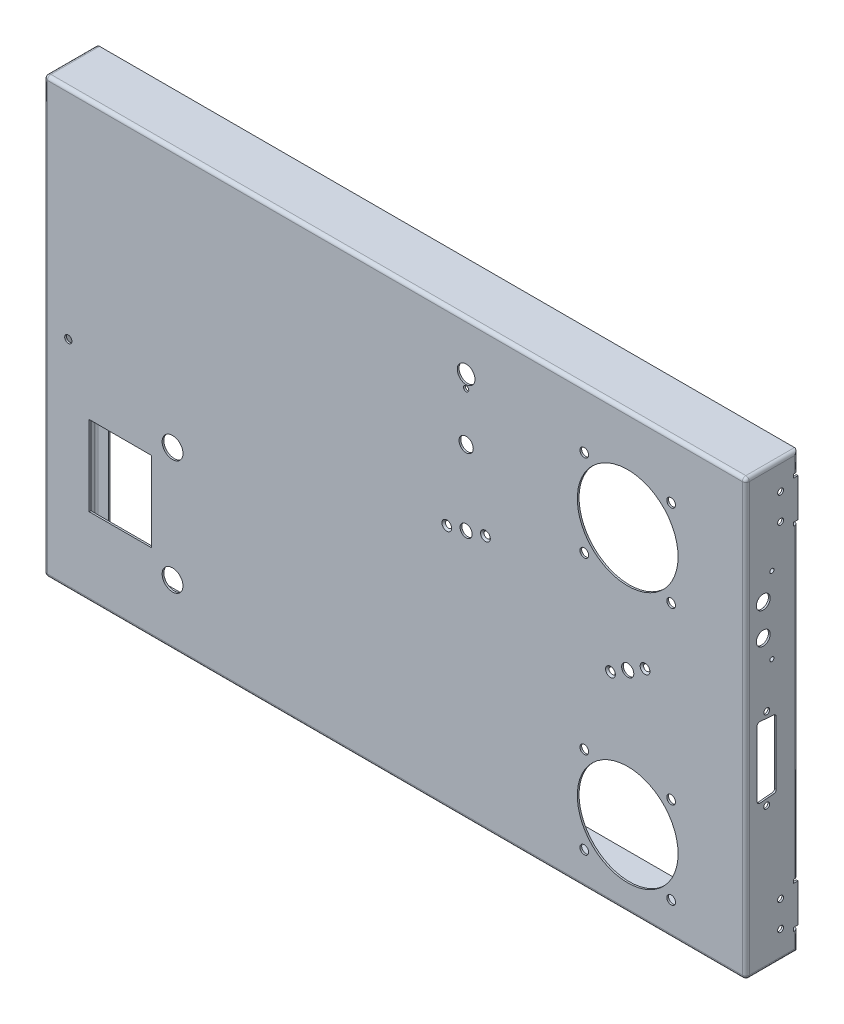
from build123d import *

# Parameters (mm, degrees)
SKETCH_1_W          = 404
SKETCH_1_H          = 250
SKETCH_1_R          = 3.5
SKETCH_1_R_2        = 6
SKETCH_1_R_3        = 29
SKETCH_1_R_4        = 2.5
SKETCH_1_R_5        = 1.8
SKETCH_1_R_6        = 5.1
SKETCH_1_R_7        = 1.5
SKETCH_1_R_8        = 4.1
SKETCH_1_R_9        = 2.1
SKETCH_1_W_2        = 36
SKETCH_1_H_2        = 46
EXTRUDE_1_DEPTH     = 1
SKETCH_2_W          = 1
SKETCH_2_H          = 250
EXTRUDE_2_DEPTH     = 30
SKETCH_3_W          = 1
SKETCH_3_H          = 250
EXTRUDE_3_DEPTH     = 8
SKETCH_4_W          = 1
SKETCH_4_H          = 250
EXTRUDE_4_DEPTH     = 8
SKETCH_5_R          = 1.7
SKETCH_5_R_2        = 4
SKETCH_5_R_3        = 1.2
CUT_EXTRUDE_1_DEPTH = 8
CHAMFER_2_SIZE      = 1
SKETCH_6_W          = 404
SKETCH_6_H          = 1
SKETCH_6_W_2        = 403
EXTRUDE_5_DEPTH     = 30
FILLET_1_R          = 1
FILLET_2_R          = 2
SKETCH_7_W          = 39.273398561
SKETCH_7_H          = 2
CUT_EXTRUDE_2_DEPTH = 2.5
SKETCH_8_W          = 16.105327303
SKETCH_8_H          = 23.169067349
SKETCH_8_W_2        = 20.44042911
SKETCH_8_H_2        = 24.240130898
CUT_EXTRUDE_3_DEPTH = 2
SKETCH_9_W          = 1
SKETCH_9_H          = 22
EXTRUDE_6_DEPTH     = 2
SKETCH_10_R         = 2.5
SKETCH_10_R_2       = 1.2
EXTRUDE_7_DEPTH     = 1.5


with BuildPart() as part:
    # Эскиз1 → Вытянуть1 (new body)
    with BuildSketch(Plane.XY):
        Rectangle(SKETCH_1_W, SKETCH_1_H)
        with Locations((134, -4)):
            Circle(SKETCH_1_R, mode=Mode.SUBTRACT)
        with Locations((-128, -24)):
            Circle(SKETCH_1_R_2, mode=Mode.SUBTRACT)
        with Locations((-128, -90)):
            Circle(SKETCH_1_R_2, mode=Mode.SUBTRACT)
        with Locations((134, 67)):
            Circle(SKETCH_1_R_3, mode=Mode.SUBTRACT)
        with Locations((109, 92)):
            Circle(SKETCH_1_R_4, mode=Mode.SUBTRACT)
        with Locations((109, 42)):
            Circle(SKETCH_1_R_4, mode=Mode.SUBTRACT)
        with Locations((159, 42)):
            Circle(SKETCH_1_R_4, mode=Mode.SUBTRACT)
        with Locations((159, 92)):
            Circle(SKETCH_1_R_4, mode=Mode.SUBTRACT)
        with Locations((124.06636679, -9.794215326)):
            Circle(SKETCH_1_R_5, mode=Mode.SUBTRACT)
        with Locations((143.984951077, 1.705784674)):
            Circle(SKETCH_1_R_5, mode=Mode.SUBTRACT)
        with Locations((134, -81)):
            Circle(SKETCH_1_R_3, mode=Mode.SUBTRACT)
        with Locations((109, -56)):
            Circle(SKETCH_1_R_4, mode=Mode.SUBTRACT)
        with Locations((159, -56)):
            Circle(SKETCH_1_R_4, mode=Mode.SUBTRACT)
        with Locations((159, -106)):
            Circle(SKETCH_1_R_4, mode=Mode.SUBTRACT)
        with Locations((109, -106)):
            Circle(SKETCH_1_R_4, mode=Mode.SUBTRACT)
        with Locations((41, 97)):
            Circle(SKETCH_1_R_6, mode=Mode.SUBTRACT)
        with Locations((41, 89.8)):
            Circle(SKETCH_1_R_7, mode=Mode.SUBTRACT)
        with Locations((41, 62)):
            Circle(SKETCH_1_R_8, mode=Mode.SUBTRACT)
        with Locations((41, 19)):
            Circle(SKETCH_1_R, mode=Mode.SUBTRACT)
        with Locations((29.888232445, 16.03712609)):
            Circle(SKETCH_1_R_5, mode=Mode.SUBTRACT)
        with Locations((52.10452645, 21.989964127)):
            Circle(SKETCH_1_R_5, mode=Mode.SUBTRACT)
        with Locations((-188, 0)):
            Circle(SKETCH_1_R_9, mode=Mode.SUBTRACT)
        with Locations((-158, -57)):
            Rectangle(SKETCH_1_W_2, SKETCH_1_H_2, mode=Mode.SUBTRACT)
    extrude(amount=EXTRUDE_1_DEPTH)

    # Эскиз2 → Вытянуть2 (add)
    with BuildSketch(Plane.XY.offset(1)):
        with Locations((201.5, 0)):
            Rectangle(SKETCH_2_W, SKETCH_2_H)
        with Locations((-201.5, 0)):
            Rectangle(SKETCH_2_W, SKETCH_2_H)
    extrude(amount=-EXTRUDE_2_DEPTH)

    # Эскиз3 → Вытянуть3 (add)
    with BuildSketch(Plane.ZY.offset(202)):
        with Locations((-28.5, 0)):
            Rectangle(SKETCH_3_W, SKETCH_3_H)
    extrude(amount=-EXTRUDE_3_DEPTH)

    # Эскиз4 → Вытянуть4 (add)
    with BuildSketch(Plane(origin=(202, 0, 0), x_dir=(0, 0, -1), z_dir=(1, 0, 0))):
        with Locations((28.5, 0)):
            Rectangle(SKETCH_4_W, SKETCH_4_H)
    extrude(amount=-EXTRUDE_4_DEPTH)

    # Эскиз5 → Вырез-Вытянуть1 (cut)
    with BuildSketch(Plane(origin=(202, 0, 0), x_dir=(0, 0, -1), z_dir=(1, 0, 0))):
        with Locations(Location((19, -109, 0), (0, 0, 90))):
            Circle(SKETCH_5_R)
        with Locations(Location((19, 109, 0), (0, 0, 270))):
            Circle(SKETCH_5_R)
        with Locations(Location((11, 3.5, 0), (0, 0, 90))):
            Circle(SKETCH_5_R)
        with Locations(Location((11, -43.5, 0), (0, 0, 90))):
            Circle(SKETCH_5_R)
        with Locations(Location((9, 59, 0), (0, 0, 90))):
            Circle(SKETCH_5_R_2)
        with Locations(Location((9, 41, 0), (0, 0, 90))):
            Circle(SKETCH_5_R_2)
        with Locations(Location((14, 72, 0), (0, 0, 90))):
            Circle(SKETCH_5_R_3)
        with Locations(Location((14, 28, 0), (0, 0, 90))):
            Circle(SKETCH_5_R_3)
        with Locations(Location((19, -94, 0), (0, 0, 90))):
            Circle(SKETCH_5_R)
        with Locations(Location((19, 94, 0), (0, 0, 270))):
            Circle(SKETCH_5_R)
        with BuildLine():
            Line((7.135803619, 0.35129058), (15.135803619, -0.375982147))
            ThreePointArc((15.135803619, -0.375982147), (16.107633836, -0.858314525), (16.5, -1.869821957))
            Line((16.5, -1.869821957), (16.5, -38.130178043))
            ThreePointArc((16.5, -38.130178043), (16.107633836, -39.141685475), (15.135803619, -39.624017853))
            Line((15.135803619, -39.624017853), (7.135803619, -40.35129058))
            ThreePointArc((7.135803619, -40.35129058), (5.988492568, -39.965084606), (5.5, -38.85745077))
            Line((5.5, -38.85745077), (5.5, -1.14254923))
            ThreePointArc((5.5, -1.14254923), (5.988492568, -0.034915394), (7.135803619, 0.35129058))
        make_face()
    extrude(amount=-CUT_EXTRUDE_1_DEPTH, mode=Mode.SUBTRACT)

    # Фаска2
    chamfer_2_edges = [part.edges().sort_by_distance(p)[0] for p in [
        (122.26636679, -9.794215326, 1),
        (28.088232445, 16.03712609, 1),
        (50.30452645, 21.989964127, 1),
        (142.184951077, 1.705784674, 1),
    ]]
    chamfer(chamfer_2_edges, length=CHAMFER_2_SIZE - 0.0001)  # a hair under: the kernel refuses the full size

    # Эскиз6 → Вытянуть5 (add)
    with BuildSketch(Plane.XY.offset(1)):
        with Locations((0, 124.5)):
            Rectangle(SKETCH_6_W, SKETCH_6_H)
        with Locations((-0.5, -124.5)):
            Rectangle(SKETCH_6_W_2, SKETCH_6_H)
    extrude(amount=-EXTRUDE_5_DEPTH)

    # Скругление1
    fillet_1_edges = [part.edges().sort_by_distance(p)[0] for p in [
        (-201, 0, 0),
        (0, 124, 0),
        (201, 0, 0),
        (0, -124, 0),
        (201, 0, -28),
        (-201, 0, -28),
    ]]
    fillet(fillet_1_edges, radius=FILLET_1_R)

    # Скругление2
    fillet_2_edges = [part.edges().sort_by_distance(p)[0] for p in [
        (0, 125, 1),
        (-202, 0, 1),
        (0, -125, 1),
        (202, 0, 1),
        (-202, 0, -29),
        (202, 0, -29),
        (-202, 125, -14),
        (202, 125, -14),
        (-202, -125, -14),
        (202, -125, -14),
    ]]
    fillet(fillet_2_edges, radius=FILLET_2_R)

    # Эскиз7 → Вырез-Вытянуть2 (cut)
    with BuildSketch(Plane(origin=(0, 0, -29), x_dir=(-1, 0, 0), z_dir=(0, 0, -1))):
        with Locations((-204.595711045, -113)):
            Rectangle(SKETCH_7_W, SKETCH_7_H)
        with Locations((-204.595711045, 113)):
            Rectangle(SKETCH_7_W, SKETCH_7_H)
        with Locations((-204.595711045, -89)):
            Rectangle(SKETCH_7_W, SKETCH_7_H)
        with Locations((-204.595711045, 89)):
            Rectangle(SKETCH_7_W, SKETCH_7_H)
    extrude(amount=-CUT_EXTRUDE_2_DEPTH, mode=Mode.SUBTRACT)

    # Эскиз8 → Вырез-Вытянуть3 (cut)
    with BuildSketch(Plane(origin=(0, 0, -29), x_dir=(-1, 0, 0), z_dir=(0, 0, -1))):
        with Locations((-198.211121585, 101.246537182)):
            Rectangle(SKETCH_8_W, SKETCH_8_H)
        with Locations((-197.698675363, -101.007536633)):
            Rectangle(SKETCH_8_W_2, SKETCH_8_H_2)
    extrude(amount=-CUT_EXTRUDE_3_DEPTH, mode=Mode.SUBTRACT)

    # Эскиз9 → Вытянуть6 (add)
    with BuildSketch(Plane(origin=(0, 0, -27), x_dir=(-1, 0, 0), z_dir=(0, 0, -1))):
        with Locations((-201.5, 101)):
            Rectangle(SKETCH_9_W, SKETCH_9_H)
        with Locations((-201.5, -101)):
            Rectangle(SKETCH_9_W, SKETCH_9_H)
    extrude(amount=EXTRUDE_6_DEPTH)

    # Эскиз10 → Вытянуть7 (add)
    # profile 1 of 2: a face of its own
    with BuildSketch(Plane.ZY.offset(-201)):
        with Locations(Location((-14, 28, 0), (0, 0, 270))):
            Circle(SKETCH_10_R)
        with Locations(Location((-14, 28, 0), (0, 0, 90))):
            Circle(SKETCH_10_R_2, mode=Mode.SUBTRACT)
    # profile 2 of 2: a face of its own
    with BuildSketch(Plane.ZY.offset(-201)):
        with Locations(Location((-14, 72, 0), (0, 0, 270))):
            Circle(SKETCH_10_R)
        with Locations(Location((-14, 72, 0), (0, 0, 90))):
            Circle(SKETCH_10_R_2, mode=Mode.SUBTRACT)
    extrude(amount=EXTRUDE_7_DEPTH)


solid = part.part
